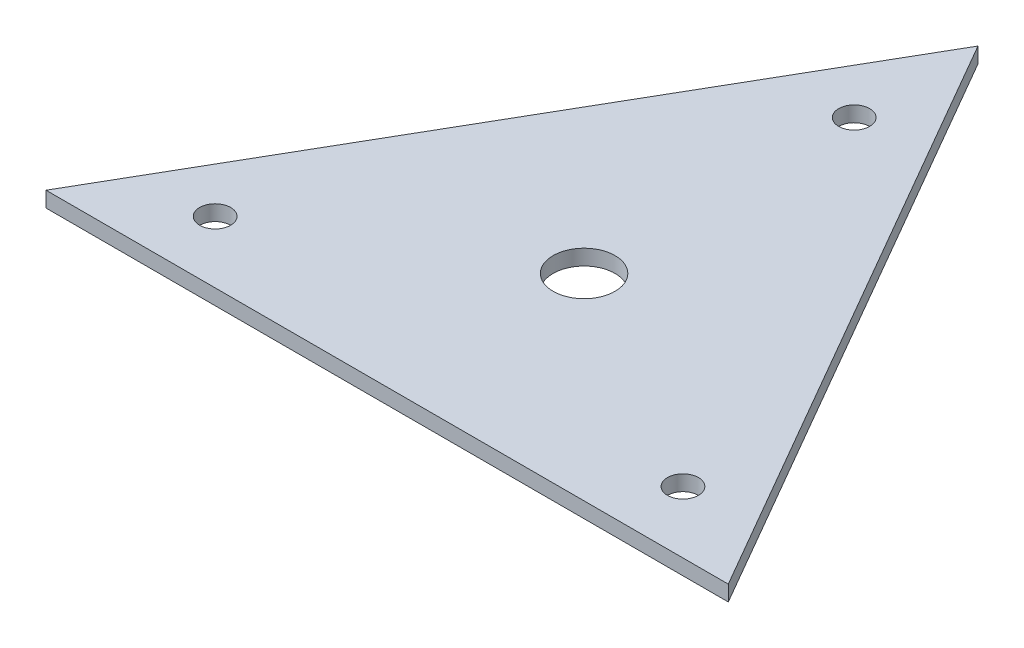
from build123d import *

# Parameters (mm, degrees)
SKETCH1_R           = 6.35
SKETCH1_R_2         = 3.175
BOSS_EXTRUDE1_DEPTH = 3.175
SKETCH2_R           = 6.35
CUT_EXTRUDE1_DEPTH  = 0.254


with BuildPart() as part:
    # Sketch1 → Boss-Extrude1 (new body)
    with BuildSketch(Plane(origin=(0, 0, 0), x_dir=(1, 0, 0), z_dir=(0, 1, 0))):
        Polygon((0, 0), (139.954, 0), (69.977, 121.203719361), align=None)
        with Locations((69.977, 40.401239787)):
            Circle(SKETCH1_R, mode=Mode.SUBTRACT)
        with Locations((117.956954744, 12.7)):
            Circle(SKETCH1_R_2, mode=Mode.SUBTRACT)
        with Locations((21.997045256, 12.7)):
            Circle(SKETCH1_R_2, mode=Mode.SUBTRACT)
        with Locations((69.977, 95.803719361)):
            Circle(SKETCH1_R_2, mode=Mode.SUBTRACT)
    extrude(amount=BOSS_EXTRUDE1_DEPTH)

    # Sketch2 → Cut-Extrude1 (cut)
    with BuildSketch(Plane(origin=(0, 0, 0), x_dir=(1, 0, 0), z_dir=(0, 1, 0))):
        with Locations((93.966977372, 54.251859681)):
            Circle(SKETCH2_R)
        with Locations((69.977, 12.7)):
            Circle(SKETCH2_R)
        with Locations((45.987022628, 54.251859681)):
            Circle(SKETCH2_R)
    extrude(amount=CUT_EXTRUDE1_DEPTH, mode=Mode.SUBTRACT)


solid = part.part
